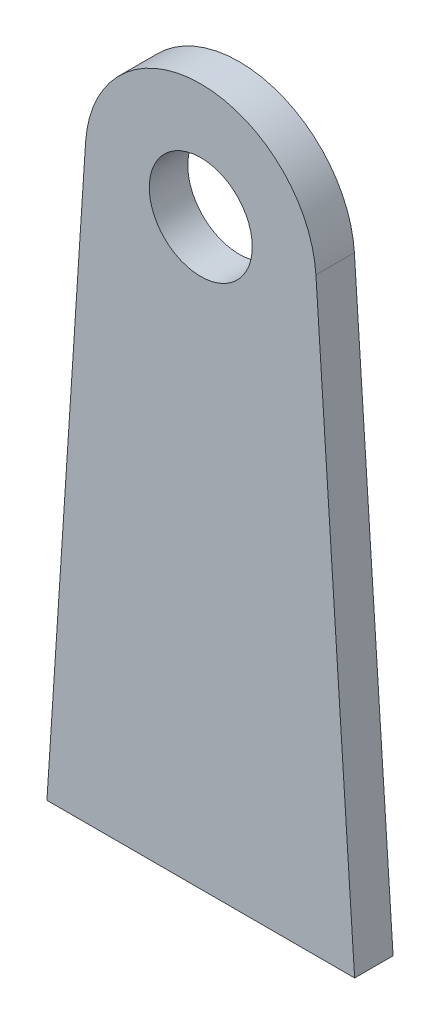
from build123d import *

# Parameters (mm, degrees)
SKETCH1_R           = 4.25
BOSS_EXTRUDE1_DEPTH = 3.175


with BuildPart() as part:
    # Sketch1 → Boss-Extrude1 (new body)
    with BuildSketch(Plane.XY):
        with BuildLine():
            ThreePointArc((9.504534641, 0.624056297), (0, 9.525), (-9.504534641, 0.624056297))
            Line((-9.504534641, 0.624056297), (-12.7, -48.043686238))
            Line((-12.7, -48.043686238), (12.7, -48.043686238))
            Line((12.7, -48.043686238), (9.504534641, 0.624056297))
        make_face()
        Circle(SKETCH1_R, mode=Mode.SUBTRACT)
    extrude(amount=BOSS_EXTRUDE1_DEPTH)


solid = part.part
